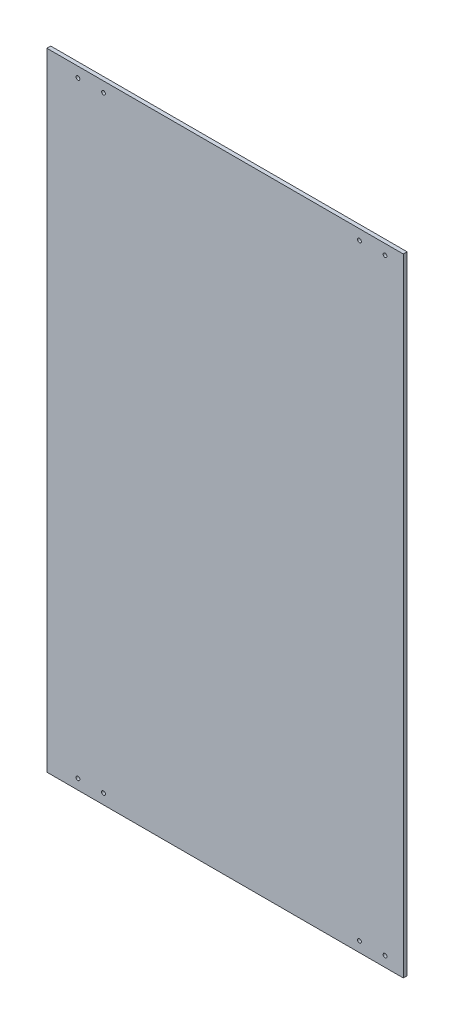
from build123d import *

# Parameters (mm, degrees)
SKETCH_1_W      = 278.56
SKETCH_1_H      = 490
SKETCH_1_R      = 1.5
EXTRUDE_1_DEPTH = 3


with BuildPart() as part:
    # 草图1 → 凸台-拉伸1 (new body)
    with BuildSketch(Plane.XY):
        Rectangle(SKETCH_1_W, SKETCH_1_H)
        with Locations((104.999070074, 237)):
            Circle(SKETCH_1_R, mode=Mode.SUBTRACT)
        with Locations((124.999070074, 237)):
            Circle(SKETCH_1_R, mode=Mode.SUBTRACT)
        with Locations((-95.000929926, 237)):
            Circle(SKETCH_1_R, mode=Mode.SUBTRACT)
        with Locations((-115.000929926, 237)):
            Circle(SKETCH_1_R, mode=Mode.SUBTRACT)
        with Locations((124.999070074, -237)):
            Circle(SKETCH_1_R, mode=Mode.SUBTRACT)
        with Locations((104.999070074, -237)):
            Circle(SKETCH_1_R, mode=Mode.SUBTRACT)
        with Locations((-95.000929926, -237)):
            Circle(SKETCH_1_R, mode=Mode.SUBTRACT)
        with Locations((-115.000929926, -237)):
            Circle(SKETCH_1_R, mode=Mode.SUBTRACT)
    extrude(amount=EXTRUDE_1_DEPTH)


solid = part.part
